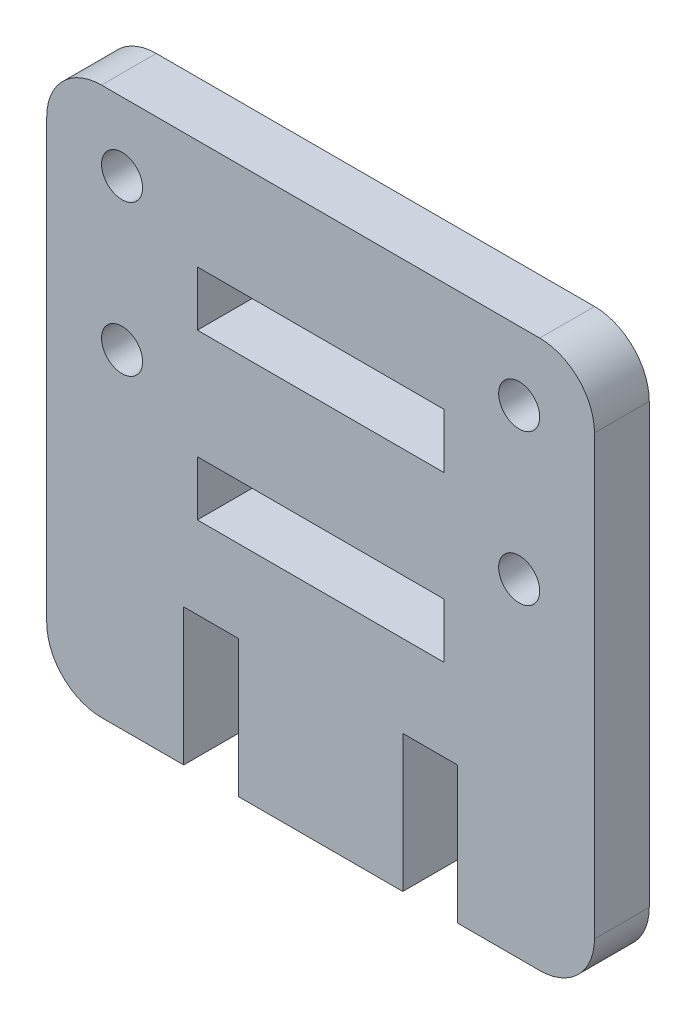
from build123d import *

# Parameters (mm, degrees)
MODEL_R             = 0.75
MODEL_W             = 9
MODEL_H             = 2
BOSS_EXTRUDE1_DEPTH = 2


with BuildPart() as part:
    # Model → Boss-Extrude1 (new body)
    with BuildSketch(Plane.XY):
        with BuildLine():
            Line((2, 0), (5, 0))
            Line((5, 0), (5, 5))
            Line((5, 5), (7, 5))
            Line((7, 5), (7, 0))
            Line((7, 0), (13, 0))
            Line((13, 0), (13, 5))
            Line((13, 5), (15, 5))
            Line((15, 5), (15, 0))
            Line((15, 0), (18, 0))
            ThreePointArc((18, 0), (19.414213562, 0.585786438), (20, 2))
            Line((20, 2), (20, 18))
            ThreePointArc((20, 18), (19.414213562, 19.414213562), (18, 20))
            Line((18, 20), (2, 20))
            ThreePointArc((2, 20), (0.585786438, 19.414213562), (0, 18))
            Line((0, 18), (0, 2))
            ThreePointArc((0, 2), (0.585786438, 0.585786438), (2, 0))
        make_face()
        with Locations((2.75, 17.5)):
            Circle(MODEL_R, mode=Mode.SUBTRACT)
        with Locations((2.75, 12)):
            Circle(MODEL_R, mode=Mode.SUBTRACT)
        with Locations((17.25, 12)):
            Circle(MODEL_R, mode=Mode.SUBTRACT)
        with Locations((17.25, 17.5)):
            Circle(MODEL_R, mode=Mode.SUBTRACT)
        with Locations((10, 9)):
            Rectangle(MODEL_W, MODEL_H, mode=Mode.SUBTRACT)
        with Locations((10, 15)):
            Rectangle(MODEL_W, MODEL_H, mode=Mode.SUBTRACT)
    extrude(amount=BOSS_EXTRUDE1_DEPTH)


solid = part.part
